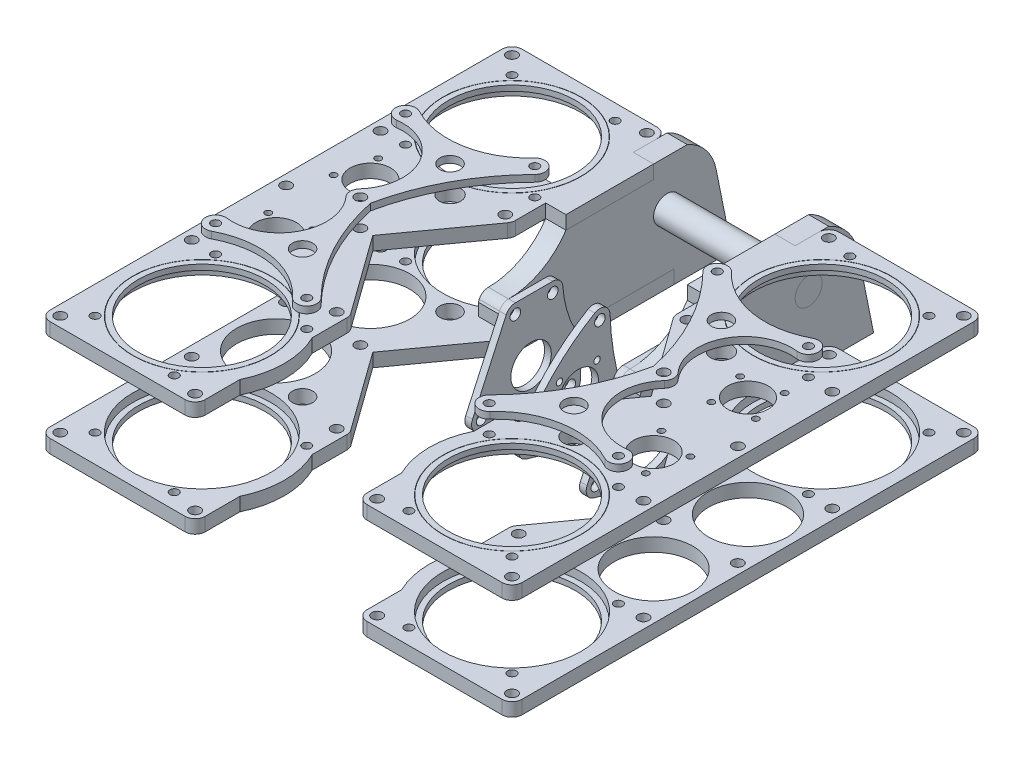
from build123d import *

# Parameters (mm, degrees)
SKETCH3_R               = 32.5
SKETCH3_R_2             = 2.4892
SKETCH3_R_3             = 18.5166
SKETCH3_R_4             = 4.7625
BOSS_EXTRUDE1_DEPTH     = 6.35
SKETCH4_R               = 2.4892
SKETCH4_R_2             = 5.08
SKETCH4_R_3             = 9.525
SKETCH4_R_4             = 32.5
SKETCH4_R_5             = 2.0193
BOSS_EXTRUDE2_DEPTH     = 6.35
SKETCH6_R               = 4.7625
SKETCH6_R_2             = 2.0193
SKETCH6_R_3             = 2.4892
BOSS_EXTRUDE3_DEPTH     = 3.175
SKETCH13_R              = 32.373
SKETCH13_R_2            = 29.833
BOSS_EXTRUDE7_DEPTH     = 2.525
SKETCH14_R              = 32.373
SKETCH14_R_2            = 29.833
BOSS_EXTRUDE8_DEPTH     = 2.525
SKETCH8_R               = 1.5
CUT_EXTRUDE1_DEPTH      = 103.340208527
CUT_EXTRUDE2_DEPTH      = 103.340208527
CUT_EXTRUDE2_DEPTH_BACK = 103.340208527
SKETCH9_R               = 2.0193
BODY_MOVE_COPY1_ANGLE   = 90
BODY_MOVE_COPY1_2_ANGLE = 90
BODY_MOVE_COPY1_3_ANGLE = 90
BODY_MOVE_COPY1_4_ANGLE = 90
BODY_MOVE_COPY1_5_ANGLE = 90
SKETCH15_R              = 18.5166
CUT_EXTRUDE3_DEPTH      = 6.35
SKETCH18_W              = 9.525
SKETCH18_H              = 50.8
BOSS_EXTRUDE9_DEPTH     = 6.35
SKETCH19_W              = 9.525
SKETCH19_H              = 41.275
BOSS_EXTRUDE10_DEPTH    = 6.35
SKETCH20_R              = 6.35
BOSS_EXTRUDE11_DEPTH    = 9.525
SKETCH21_R              = 2.4892
BOSS_EXTRUDE12_DEPTH    = 3.175
CUT_EXTRUDE7_DEPTH      = 9.525
SKETCH22_R              = 2.4892
SKETCH22_R_2            = 1.5
SKETCH22_R_3            = 9.525
BOSS_EXTRUDE13_DEPTH    = 3.175
SKETCH23_R              = 9.525
CUT_EXTRUDE4_DEPTH      = 3.175
SKETCH24_R              = 17.78
CUT_EXTRUDE6_DEPTH      = 3.175
SKETCH25_R              = 6.35
BOSS_EXTRUDE14_DEPTH    = 76.2


with BuildPart() as part:
    # Sketch3 → Boss-Extrude1 (new body)
    with BuildSketch(Plane(origin=(0, 27.925, 0), x_dir=(1, 0, 0), z_dir=(0, 1, 0))):
        with BuildLine():
            Line((-38.1, 30.1625), (-38.1, -33.3375))
            ThreePointArc((-38.1, -33.3375), (-36.705096045, -36.705096045), (-33.3375, -38.1))
            Line((-33.3375, -38.1), (73.025, -38.1))
            ThreePointArc((73.025, -38.1), (76.392596045, -36.705096045), (77.7875, -33.3375))
            Line((77.7875, -33.3375), (77.7875, 1.5875))
            ThreePointArc((77.7875, 1.5875), (77.263765098, 3.758738516), (75.807751257, 5.452432301))
            Line((75.807751257, 5.452432301), (36.120251257, 34.027432301))
            ThreePointArc((36.120251257, 34.027432301), (34.799462066, 34.695057023), (33.3375, 34.925))
            Line((33.3375, 34.925), (17.016664626, 34.925))
            ThreePointArc((17.016664626, 34.925), (0, 38.85), (-17.016664626, 34.925))
            Line((-17.016664626, 34.925), (-33.3375, 34.925))
            ThreePointArc((-33.3375, 34.925), (-36.705096045, 33.530096045), (-38.1, 30.1625))
        make_face()
        with Locations(Location((0, 0, 0), (0, 0, 270))):
            Circle(SKETCH3_R, mode=Mode.SUBTRACT)
        with Locations(Location((-33.3375, 30.1625, 0), (0, 0, 270))):
            Circle(SKETCH3_R_2, mode=Mode.SUBTRACT)
        with Locations(Location((-33.3375, -33.3375, 0), (0, 0, 270))):
            Circle(SKETCH3_R_2, mode=Mode.SUBTRACT)
        with Locations(Location((28.575, -33.3375, 0), (0, 0, 270))):
            Circle(SKETCH3_R_2, mode=Mode.SUBTRACT)
        with Locations(Location((50.8, -15.875, 0), (0, 0, 270))):
            Circle(SKETCH3_R_3, mode=Mode.SUBTRACT)
        with Locations(Location((38.300729341, 9.113233891, 0), (0, 0, 270))):
            Circle(SKETCH3_R_4, mode=Mode.SUBTRACT)
        with Locations(Location((73.025, -33.3375, 0), (0, 0, 270))):
            Circle(SKETCH3_R_2, mode=Mode.SUBTRACT)
        with Locations(Location((73.025, 1.5875, 0), (0, 0, 270))):
            Circle(SKETCH3_R_2, mode=Mode.SUBTRACT)
        with Locations(Location((33.3375, 30.1625, 0), (0, 0, 270))):
            Circle(SKETCH3_R_2, mode=Mode.SUBTRACT)
    extrude(amount=-BOSS_EXTRUDE1_DEPTH)


with BuildPart() as body_2:
    # Sketch4 → Boss-Extrude2 (new body)
    with BuildSketch(Plane(origin=(0, 69.2, 0), x_dir=(1, 0, 0), z_dir=(0, 1, 0))):
        with BuildLine():
            Line((75.807751257, 5.452432301), (36.120251257, 34.027432301))
            ThreePointArc((36.120251257, 34.027432301), (34.799462066, 34.695057023), (33.3375, 34.925))
            Line((33.3375, 34.925), (17.016664626, 34.925))
            ThreePointArc((17.016664626, 34.925), (0, 38.85), (-17.016664626, 34.925))
            Line((-17.016664626, 34.925), (-33.3375, 34.925))
            ThreePointArc((-33.3375, 34.925), (-36.705096045, 33.530096045), (-38.1, 30.1625))
            Line((-38.1, 30.1625), (-38.1, -33.3375))
            ThreePointArc((-38.1, -33.3375), (-36.705096045, -36.705096045), (-33.3375, -38.1))
            Line((-33.3375, -38.1), (73.025, -38.1))
            ThreePointArc((73.025, -38.1), (76.392596045, -36.705096045), (77.7875, -33.3375))
            Line((77.7875, -33.3375), (77.7875, 1.5875))
            ThreePointArc((77.7875, 1.5875), (77.263765098, 3.758738516), (75.807751257, 5.452432301))
        make_face()
        with Locations(Location((33.3375, 30.1625, 0), (0, 0, 270))):
            Circle(SKETCH4_R, mode=Mode.SUBTRACT)
        with Locations(Location((73.025, 1.5875, 0), (0, 0, 270))):
            Circle(SKETCH4_R, mode=Mode.SUBTRACT)
        with Locations(Location((73.025, -33.3375, 0), (0, 0, 270))):
            Circle(SKETCH4_R, mode=Mode.SUBTRACT)
        with Locations(Location((28.575, -33.3375, 0), (0, 0, 270))):
            Circle(SKETCH4_R, mode=Mode.SUBTRACT)
        with Locations(Location((-33.3375, -33.3375, 0), (0, 0, 270))):
            Circle(SKETCH4_R, mode=Mode.SUBTRACT)
        with Locations(Location((-33.3375, 30.1625, 0), (0, 0, 270))):
            Circle(SKETCH4_R, mode=Mode.SUBTRACT)
        with Locations(Location((38.300729341, 9.113233891, 0), (0, 0, 270))):
            Circle(SKETCH4_R_2, mode=Mode.SUBTRACT)
        with Locations(Location((50.8, -15.875, 0), (0, 0, 270))):
            Circle(SKETCH4_R_3, mode=Mode.SUBTRACT)
        with Locations(Location((0, 0, 0), (0, 0, 270))):
            Circle(SKETCH4_R_4, mode=Mode.SUBTRACT)
        with Locations(Location((19.332478919, 30.058204223, 0), (0, 0, 270))):
            Circle(SKETCH4_R_5, mode=Mode.SUBTRACT)
        with Locations(Location((28.295721181, -21.830999635, 0), (0, 0, 270))):
            Circle(SKETCH4_R_5, mode=Mode.SUBTRACT)
    extrude(amount=BOSS_EXTRUDE2_DEPTH)

    # Sketch8 → Cut-Extrude1 (cut, through all)
    with BuildSketch(Plane(origin=(0, 75.55, 0), x_dir=(1, 0, 0), z_dir=(0, 1, 0))):
        with Locations(Location((43.992012062, -5.391617901, 0), (0, 0, 270))):
            Circle(SKETCH8_R)
        with Locations(Location((61.283382099, -9.067012062, 0), (0, 0, 270))):
            Circle(SKETCH8_R)
        with Locations(Location((57.607987938, -26.358382099, 0), (0, 0, 270))):
            Circle(SKETCH8_R)
        with Locations(Location((40.316617901, -22.682987938, 0), (0, 0, 270))):
            Circle(SKETCH8_R)
    extrude(amount=-CUT_EXTRUDE1_DEPTH, mode=Mode.SUBTRACT)


with BuildPart() as body_3:
    # Sketch6 → Boss-Extrude3 (new body)
    with BuildSketch(Plane(origin=(0, 85.075, 0), x_dir=(1, 0, 0), z_dir=(0, 1, 0))):
        with BuildLine():
            ThreePointArc((22.672646369, 33.45300726), (15.8732068, 33.331557649), (16.127183597, 26.535777765))
            ThreePointArc((16.127183597, 26.535777765), (28.028810929, 4.841643425), (24.094510053, -19.587958998))
            ThreePointArc((24.094510053, -19.587958998), (27.420958959, -26.512473474), (33.023429019, -21.256382505))
            ThreePointArc((33.023429019, -21.256382505), (44.777352309, 1.114782062), (69.859305694, -1.970559276))
            ThreePointArc((69.859305694, -1.970559276), (77.287217132, -0.53733208), (73.961024715, 6.257110689))
            ThreePointArc((73.961024715, 6.257110689), (46.333080487, 16.113921795), (22.672646369, 33.45300726))
        make_face()
        with Locations(Location((38.300729341, 9.113233891, 0), (0, 0, 270))):
            Circle(SKETCH6_R, mode=Mode.SUBTRACT)
        with Locations(Location((28.295721181, -21.830999635, 0), (0, 0, 270))):
            Circle(SKETCH6_R_2, mode=Mode.SUBTRACT)
        with Locations(Location((73.025, 1.5875, 0), (0, 0, 270))):
            Circle(SKETCH6_R_3, mode=Mode.SUBTRACT)
        with Locations(Location((19.332478919, 30.058204223, 0), (0, 0, 270))):
            Circle(SKETCH6_R_2, mode=Mode.SUBTRACT)
    extrude(amount=BOSS_EXTRUDE3_DEPTH)


with BuildPart() as body_4:
    # Sketch13 → Boss-Extrude7 (new body)
    with BuildSketch(Plane(origin=(0, 75.55, 0), x_dir=(1, 0, 0), z_dir=(0, 1, 0))):
        with Locations(Location((0, 0, 0), (0, 0, 270))):
            Circle(SKETCH13_R)
        with Locations(Location((0, 0, 0), (0, 0, 270))):
            Circle(SKETCH13_R_2, mode=Mode.SUBTRACT)
    extrude(amount=-BOSS_EXTRUDE7_DEPTH)


with BuildPart() as body_5:
    # Sketch14 → Boss-Extrude8 (new body)
    with BuildSketch(Plane.XZ.offset(-21.575)):
        with Locations(Location((0, 0, 0), (0, 0, 270))):
            Circle(SKETCH14_R)
        with Locations(Location((0, 0, 0), (0, 0, 270))):
            Circle(SKETCH14_R_2, mode=Mode.SUBTRACT)
    extrude(amount=-BOSS_EXTRUDE8_DEPTH)


with BuildPart() as cut_extrude2_tool:
    # Sketch9 → Cut-Extrude2 (new, two sides: drawn at the far end of the back side and taken through both)
    with BuildSketch(Plane(origin=(0, 75.55, 0), x_dir=(1, 0, 0), z_dir=(0, 1, 0)).offset(-CUT_EXTRUDE2_DEPTH_BACK)):
        with Locations(Location((-25.145212114, -25.145212114, 0), (0, 0, 270))):
            Circle(SKETCH9_R)
        with Locations(Location((-30.796469576, 17.78035, 0), (0, 0, 270))):
            Circle(SKETCH9_R)
        with Locations(Location((19.332478919, 30.058204223, 0), (0, 0, 270))):
            Circle(SKETCH9_R)
        with Locations(Location((28.295721181, -21.830999635, 0), (0, 0, 270))):
            Circle(SKETCH9_R)
    extrude(amount=CUT_EXTRUDE2_DEPTH + CUT_EXTRUDE2_DEPTH_BACK)


with BuildPart() as part_1:
    add(part.part)

    # Cut-Extrude2: cut by cut_extrude2_tool
    add(cut_extrude2_tool.part, mode=Mode.SUBTRACT)


with BuildPart() as body_2_1:
    add(body_2.part)

    # Cut-Extrude2: cut by cut_extrude2_tool
    add(cut_extrude2_tool.part, mode=Mode.SUBTRACT)


with BuildPart() as body_5_1:
    # Body-Move/Copy1: read off the stored shape, not the designer's step
    # Body-Move/Copy1: moved
    add(body_5.part.moved(Location((-73.025, 0, 73.025))).rotate(Axis((0, 0, 0), (0, -1, 0)), BODY_MOVE_COPY1_ANGLE))


with BuildPart() as body_4_1:
    # Body-Move_Copy1 2: moved
    add(body_4.part.moved(Location((-73.025, 0, 73.025))).rotate(Axis((0, 0, 0), (0, -1, 0)), BODY_MOVE_COPY1_2_ANGLE))


with BuildPart() as part_2:
    # Body-Move_Copy1 3: moved
    add(part_1.part.moved(Location((-73.025, 0, 73.025))).rotate(Axis((0, 0, 0), (0, -1, 0)), BODY_MOVE_COPY1_3_ANGLE))


with BuildPart() as body_2_2:
    # Body-Move_Copy1 4: moved
    add(body_2_1.part.moved(Location((-73.025, 0, 73.025))).rotate(Axis((0, 0, 0), (0, -1, 0)), BODY_MOVE_COPY1_4_ANGLE))


with BuildPart() as body_3_1:
    # Body-Move_Copy1 5: moved
    add(body_3.part.moved(Location((-73.025, 0, 73.025))).rotate(Axis((0, 0, 0), (0, -1, 0)), BODY_MOVE_COPY1_5_ANGLE))


with BuildPart() as body_6:
    # Mirror2: mirrored copy
    add(body_3_1.part.mirror(Plane.XY))

    # Combine2: union body 3
    add(body_3_1.part)


with BuildPart() as body_7:
    # Mirror2 2: mirrored copy
    add(part_2.part.mirror(Plane.XY))

    # Combine4: union part
    add(part_2.part)

    # Sketch15 → Cut-Extrude3 (cut)
    with BuildSketch(Plane.XZ.offset(-21.575)):
        with Locations(Location((-88.9, -22.225, 0), (0, 0, 180))):
            Circle(SKETCH15_R)
        with Locations(Location((-88.9, 22.225, 0), (0, 0, 180))):
            Circle(SKETCH15_R)
    extrude(amount=-CUT_EXTRUDE3_DEPTH, mode=Mode.SUBTRACT)


with BuildPart() as body_8:
    # Mirror2 3: mirrored copy
    add(body_5_1.part.mirror(Plane.XY))


with BuildPart() as body_9:
    # Mirror2 4: mirrored copy
    add(body_4_1.part.mirror(Plane.XY))


with BuildPart() as body_10:
    # Mirror2 5: mirrored copy
    add(body_2_2.part.mirror(Plane.XY))

    # Combine3: union body 2
    add(body_2_2.part)


with BuildPart() as body_8_2:
    # Mirror3: mirrored copy
    add(body_5_1.part.mirror(Plane(origin=(0, 0, 0), x_dir=(0, 0, 1), z_dir=(1, 0, 0))))


with BuildPart() as body_9_2:
    # Mirror3 2: mirrored copy
    add(body_4_1.part.mirror(Plane(origin=(0, 0, 0), x_dir=(0, 0, 1), z_dir=(1, 0, 0))))


with BuildPart() as body_10_2:
    # Mirror3 3: mirrored copy
    add(body_8.part.mirror(Plane(origin=(0, 0, 0), x_dir=(0, 0, 1), z_dir=(1, 0, 0))))


with BuildPart() as body_11:
    # Mirror3 4: mirrored copy
    add(body_9.part.mirror(Plane(origin=(0, 0, 0), x_dir=(0, 0, 1), z_dir=(1, 0, 0))))


with BuildPart() as body_12:
    # Mirror3 5: mirrored copy
    add(body_6.part.mirror(Plane(origin=(0, 0, 0), x_dir=(0, 0, 1), z_dir=(1, 0, 0))))


with BuildPart() as body_13:
    # Mirror3 6: mirrored copy
    add(body_10.part.mirror(Plane(origin=(0, 0, 0), x_dir=(0, 0, 1), z_dir=(1, 0, 0))))


with BuildPart() as body_14:
    # Mirror3 7: mirrored copy
    add(body_7.part.mirror(Plane(origin=(0, 0, 0), x_dir=(0, 0, 1), z_dir=(1, 0, 0))))


with BuildPart() as body_7_1:
    add(body_7.part)

    add(body_14.part)  # Boss-Extrude9 merges body 14
    # Sketch18 → Boss-Extrude9 (add)
    with BuildSketch(Plane(origin=(0, 27.925, 0), x_dir=(1, 0, 0), z_dir=(0, 1, 0))):
        with Locations((-33.3375, 79.375)):
            Rectangle(SKETCH18_W, SKETCH18_H)
        with Locations((33.3375, 79.375)):
            Rectangle(SKETCH18_W, SKETCH18_H)
    extrude(amount=-BOSS_EXTRUDE9_DEPTH)


with BuildPart() as body_10_1:
    add(body_10.part)

    add(body_13.part)  # Boss-Extrude10 merges body 13
    # Sketch19 → Boss-Extrude10 (add)
    with BuildSketch(Plane(origin=(0, 75.55, 0), x_dir=(1, 0, 0), z_dir=(0, 1, 0))):
        with Locations((-33.3375, 74.6125)):
            Rectangle(SKETCH19_W, SKETCH19_H)
        with Locations((33.3375, 74.6125)):
            Rectangle(SKETCH19_W, SKETCH19_H)
    extrude(amount=-BOSS_EXTRUDE10_DEPTH)


with BuildPart() as body_13_2:
    # Sketch20 → Boss-Extrude11 (new body)
    with BuildSketch(Plane(origin=(-28.575, 0, 0), x_dir=(0, 0, -1), z_dir=(1, 0, 0))):
        with BuildLine():
            Line((104.775, 27.925), (53.975, 27.925))
            ThreePointArc((53.975, 27.925), (47.432413631, 40.223619845), (34.397916699, 45.139245568))
            Line((34.397916699, 45.139245568), (22.225, 45.139245568))
            Line((22.225, 45.139245568), (22.225, 69.2))
            Line((22.225, 69.2), (34.397916699, 69.2))
            Line((34.397916699, 69.2), (53.975, 69.2))
            Line((53.975, 69.2), (95.25, 69.2))
            Line((95.25, 69.2), (95.25, 75.55))
            Line((95.25, 75.55), (111.125, 75.55))
            ThreePointArc((111.125, 75.55), (119.98464069, 68.746974705), (124.720033838, 58.630135373))
            Line((124.720033838, 58.630135373), (132.180951614, 21.575))
            Line((132.180951614, 21.575), (104.775, 21.575))
            Line((104.775, 21.575), (104.775, 27.925))
        make_face()
        with Locations((101.6, 53.975)):
            Circle(SKETCH20_R, mode=Mode.SUBTRACT)
    extrude(amount=-BOSS_EXTRUDE11_DEPTH)

    # Sketch26 → Cut-Extrude7 (cut)
    with BuildSketch(Plane(origin=(-28.575, 0, 0), x_dir=(0, 0, -1), z_dir=(1, 0, 0))):
        with BuildLine():
            Line((22.656613838, 51.882864266), (22.225, 50.939321409))
            Line((22.225, 50.939321409), (22.225, 69.2))
            Line((22.225, 69.2), (53.975, 69.2))
            ThreePointArc((53.975, 69.2), (42.314056309, 58.529281845), (26.9875, 54.664245568))
            ThreePointArc((26.9875, 54.664245568), (24.413949102, 53.909019208), (22.656613838, 51.882864266))
        make_face()
    extrude(amount=-CUT_EXTRUDE7_DEPTH, mode=Mode.SUBTRACT)


with BuildPart() as body_14_2:
    # Sketch21 → Boss-Extrude12 (new body)
    with BuildSketch(Plane(origin=(-28.575, 0, 0), x_dir=(0, 0, -1), z_dir=(1, 0, 0))):
        with BuildLine():
            Line((26.9875, 54.664245568), (44.58260906, 54.664245568))
            ThreePointArc((44.58260906, 54.664245568), (47.828005226, 53.387259873), (49.333002662, 50.241108023))
            ThreePointArc((49.333002662, 50.241108023), (51.906159461, 37.352630358), (57.605499885, 25.509847274))
            Line((57.605499885, 25.509847274), (57.605499885, 7.9375))
            ThreePointArc((57.605499885, 7.9375), (56.161880028, 4.521882801), (52.70620714, 3.176964947))
            ThreePointArc((52.70620714, 3.176964947), (30.901271845, 5.383110262), (9.639739393, 10.700018968))
            ThreePointArc((9.639739393, 10.700018968), (6.761593686, 13.316538), (6.794098298, 17.206118699))
            Line((6.794098298, 17.206118699), (22.656613838, 51.882864266))
            ThreePointArc((22.656613838, 51.882864266), (24.413949102, 53.909019208), (26.9875, 54.664245568))
        make_face()
        with Locations((44.58260906, 49.901745568)):
            Circle(SKETCH21_R, mode=Mode.SUBTRACT)
        with Locations((52.842999885, 7.9375)):
            Circle(SKETCH21_R, mode=Mode.SUBTRACT)
        with Locations((11.12498446, 15.225)):
            Circle(SKETCH21_R, mode=Mode.SUBTRACT)
        with Locations((26.9875, 49.901745568)):
            Circle(SKETCH21_R, mode=Mode.SUBTRACT)
    extrude(amount=BOSS_EXTRUDE12_DEPTH)


with BuildPart() as body_15:
    # Mirror6: mirrored copy
    add(body_13_2.part.mirror(Plane(origin=(0, 0, 0), x_dir=(0, 0, 1), z_dir=(1, 0, 0))))


with BuildPart() as body_16:
    # Mirror6 2: mirrored copy
    add(body_14_2.part.mirror(Plane(origin=(0, 0, 0), x_dir=(0, 0, 1), z_dir=(1, 0, 0))))

    # Sketch24 → Cut-Extrude6 (cut)
    with BuildSketch(Plane(origin=(28.575, 0, 0), x_dir=(0, 0, -1), z_dir=(1, 0, 0))):
        with Locations((34.397916699, 25.4)):
            Circle(SKETCH24_R)
    extrude(amount=-CUT_EXTRUDE6_DEPTH, mode=Mode.SUBTRACT)


with BuildPart() as body_17:
    # Sketch22 → Boss-Extrude13 (new body)
    with BuildSketch(Plane(origin=(-3.175, 0, 0), x_dir=(0, 0, -1), z_dir=(1, 0, 0))):
        with BuildLine():
            ThreePointArc((52.70620714, 3.176964947), (56.711266425, 5.159385491), (57.310400098, 9.587876197))
            ThreePointArc((57.310400098, 9.587876197), (51.708577247, 29.509321314), (49.34221861, 50.067646674))
            ThreePointArc((49.34221861, 50.067646674), (46.88236231, 54.072182144), (42.183001839, 54.015538396))
            ThreePointArc((42.183001839, 54.015538396), (22.025262574, 38.186994769), (6.927980551, 17.475903027))
            ThreePointArc((6.927980551, 17.475903027), (6.703430485, 13.455461445), (9.639739393, 10.700018968))
            ThreePointArc((9.639739393, 10.700018968), (30.901271845, 5.383110262), (52.70620714, 3.176964947))
        make_face()
        with Locations((44.58260906, 49.901745568)):
            Circle(SKETCH22_R, mode=Mode.SUBTRACT)
        with Locations((52.842999885, 7.9375)):
            Circle(SKETCH22_R, mode=Mode.SUBTRACT)
        with Locations((11.12498446, 15.225)):
            Circle(SKETCH22_R, mode=Mode.SUBTRACT)
        with Locations((43.236751464, 34.238834765)):
            Circle(SKETCH22_R_2, mode=Mode.SUBTRACT)
        with Locations((43.236751464, 16.561165235)):
            Circle(SKETCH22_R_2, mode=Mode.SUBTRACT)
        with Locations((25.559081934, 16.561165235)):
            Circle(SKETCH22_R_2, mode=Mode.SUBTRACT)
        with Locations((25.559081934, 34.238834765)):
            Circle(SKETCH22_R_2, mode=Mode.SUBTRACT)
        with Locations((34.397916699, 25.4)):
            Circle(SKETCH22_R_3, mode=Mode.SUBTRACT)
    extrude(amount=-BOSS_EXTRUDE13_DEPTH)


with BuildPart() as body_14_2_1:
    add(body_14_2.part)

    # Sketch23 → Cut-Extrude4 (cut)
    with BuildSketch(Plane(origin=(-25.4, 0, 0), x_dir=(0, 0, -1), z_dir=(1, 0, 0))):
        with Locations((34.397916699, 25.4)):
            Circle(SKETCH23_R)
    extrude(amount=-CUT_EXTRUDE4_DEPTH, mode=Mode.SUBTRACT)


with BuildPart() as body_18:
    # Sketch25 → Boss-Extrude14 (new body)
    with BuildSketch(Plane.ZY.offset(38.1)):
        with Locations((-101.6, 53.975)):
            Circle(SKETCH25_R)
    extrude(amount=-BOSS_EXTRUDE14_DEPTH)


solid = Compound([body_5_1.part, body_4_1.part, body_6.part, body_8.part, body_9.part, body_8_2.part, body_9_2.part, body_10_2.part, body_11.part, body_12.part, body_7_1.part, body_10_1.part, body_13_2.part, body_15.part, body_16.part, body_17.part, body_14_2_1.part, body_18.part])
